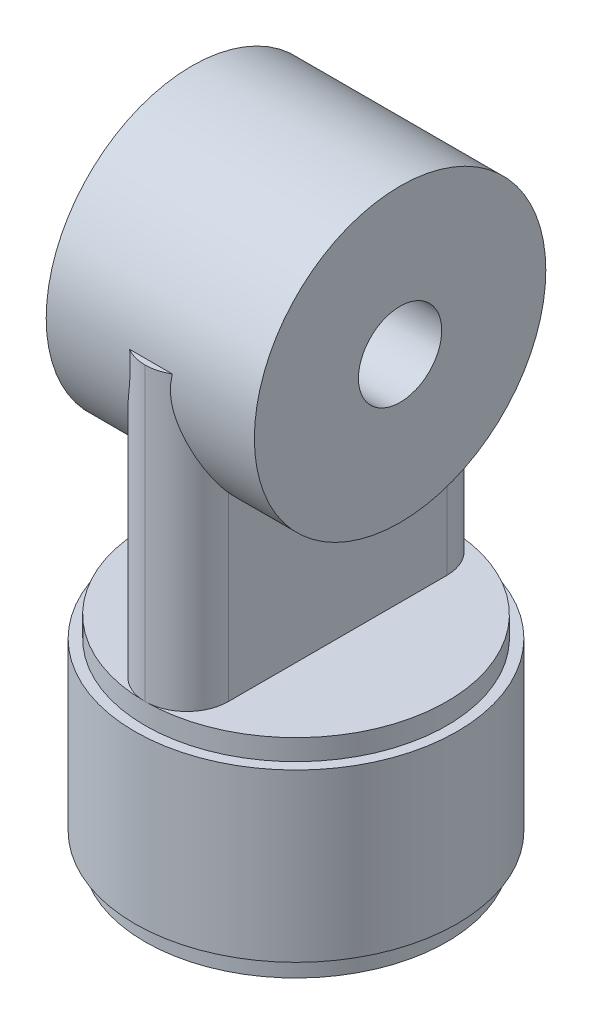
from build123d import *
from build123d.topology import SkipClean

# Parameters (mm, degrees)
BOSS_EXTRU_1_START      = 70
BOSS_EXTRU_1_DEPTH      = 70
BOSS_EXTRU_2_DEPTH      = 25
ESQUISSE7_R             = 10
ENL_V_MAT_EXTRU_1_DEPTH = 50
CONG_3_R                = 10
ECHELLE1_SCALE          = 0.25


with BuildPart() as part:
    # Esquisse1 → Révolution1 (revolve)
    with BuildSketch(Plane.XY, mode=Mode.PRIVATE) as r_volution1_sk:
        with BuildLine():
            Line((-5, 34.242293075), (-36.242368939, 34.242293075))
            Line((-36.242368939, 34.242293075), (-36.242368939, 39.242293075))
            Line((-36.242368939, 39.242293075), (-38.705375435, 39.242293075))
            Line((-38.705375435, 39.242293075), (-38.705375435, 79.242293075))
            Line((-38.705375435, 79.242293075), (-36.242368939, 79.242293075))
            Line((-36.242368939, 79.242293075), (-36.242368939, 84.242293075))
            Line((-36.242368939, 84.242293075), (-32, 84.242293075))
            Line((-32, 84.242293075), (0, 84.242293075))
            Line((0, 84.242293075), (0, 81.713773078))
            Line((0, 81.713773078), (-32, 81.713773078))
            Line((-32, 81.713773078), (-32, 51.242293075))
            ThreePointArc((-32, 51.242293075), (-31.414213562, 49.828079513), (-30, 49.242293075))
            Line((-30, 49.242293075), (-25, 49.242293075))
            Line((-25, 49.242293075), (-25, 46.233820065))
            Line((-25, 46.233820065), (-5, 46.233820065))
            Line((-5, 46.233820065), (-5, 34.242293075))
        make_face()
    revolve(r_volution1_sk.sketch.rotate(Axis((0, 190.222222222, 0), (0, -1, 0)), 270), axis=Axis((0, 190.222222222, 0), (0, -1, 0)))

    # Esquisse2 → Boss.-Extru.1 (add)
    with SkipClean():  # the faces are left unmerged after this step: merging them gives an invalid solid
        with BuildSketch(Plane(origin=(0, 84.242293075, 0), x_dir=(1, 0, 0), z_dir=(0, 1, 0)).offset(BOSS_EXTRU_1_START)):
            with BuildLine():
                Line((-10, 34.835460472), (-10, -34.835460472))
                ThreePointArc((-10, -34.835460472), (0, -36.242368939), (10, -34.835460472))
                Line((10, -34.835460472), (10, 34.835460472))
                ThreePointArc((10, 34.835460472), (0, 36.242368939), (-10, 34.835460472))
            make_face()
        extrude(amount=-BOSS_EXTRU_1_DEPTH)

    # Esquisse6 → Boss.-Extru.2 (add, symmetric)
    with SkipClean():  # the faces are left unmerged after this step: merging them gives an invalid solid
        with BuildSketch(Plane.ZY):
            with BuildLine():
                ThreePointArc((-34.835460472, 154.242293075), (0, 185.852500498), (34.835460472, 154.242293075))
                ThreePointArc((34.835460472, 154.242293075), (0, 115.852500498), (-34.835460472, 154.242293075))
            make_face()
        extrude(amount=BOSS_EXTRU_2_DEPTH, both=True)

    # Esquisse7 → Enlèv. mat.-Extru.1 (cut)
    with SkipClean():  # the faces are left unmerged after this step: merging them gives an invalid solid
        with BuildSketch(Plane.ZY.offset(25)):
            with Locations((0, 150.852500498)):
                Circle(ESQUISSE7_R)
        extrude(amount=-ENL_V_MAT_EXTRU_1_DEPTH, mode=Mode.SUBTRACT)

    # Congé3
    # the kernel refuses this fillet: 10 mm, written as the material it takes off along each edge
    with BuildSketch(Plane(origin=(10, 172.708919448, 34.835460472), x_dir=(-0.9902475852004595, 0, 0.1393187711855749), z_dir=(0, -1, 0))) as cong_3_piece_1_section:
        with BuildLine():
            CenterArc((8.705296899, 9.902475852), CONG_3_R, 188.0084284, 90)
            Line((-1.197178953, 8.50928814), (0, 0))
            ThreePointArc((0, 0), (5.049242305, -0.353450615), (10.098484611, 0))
        make_face()
    cong_3_piece_1 = extrude(amount=88.466626373, mode=Mode.PRIVATE)
    cong_3_piece_1 = cong_3_piece_1 - Plane(origin=(7.456754733, 150.852500498, 0), x_dir=(0, 0.09685121648897653, -0.9952988706235959), z_dir=(-1, 0, 0)) * Cylinder(35, 218, mode=Mode.PRIVATE)
    add(cong_3_piece_1, mode=Mode.SUBTRACT)
    with BuildSketch(Plane(origin=(10, 172.708919448, -34.835460472), x_dir=(-0.9902475852004589, 0, -0.13931877118558042), z_dir=(0, -1, 0))) as cong_3_piece_2_section:
        with BuildLine():
            CenterArc((8.705296899, -9.902475852), CONG_3_R, 81.9915716, 90)
            Line((-1.197178953, -8.50928814), (0, 0))
            ThreePointArc((0, 0), (5.049242305, 0.353450615), (10.098484611, 0))
        make_face()
    cong_3_piece_2 = extrude(amount=88.466626373, mode=Mode.PRIVATE)
    cong_3_piece_2 = cong_3_piece_2 - Plane(origin=(7.456771832, 150.852500498, 0), x_dir=(0, 0.09685121648897653, -0.9952988706235959), z_dir=(-1, 0, 0)) * Cylinder(35, 218, mode=Mode.PRIVATE)
    add(cong_3_piece_2, mode=Mode.SUBTRACT)
    with BuildSketch(Plane(origin=(-10, 172.708919448, -34.835460472), x_dir=(0.990247585200459, 0, -0.13931877118557906), z_dir=(0, -1, 0))) as cong_3_piece_3_section:
        with BuildLine():
            CenterArc((8.705296899, 9.902475852), CONG_3_R, 188.0084284, 90)
            Line((-1.197178953, 8.50928814), (0, 0))
            ThreePointArc((0, 0), (5.049242305, -0.353450615), (10.098484611, 0))
        make_face()
    cong_3_piece_3 = extrude(amount=88.466626373, mode=Mode.PRIVATE)
    cong_3_piece_3 = cong_3_piece_3 - Plane(origin=(-7.456771832, 150.852500498, 0), x_dir=(0, 0.09685121648897653, -0.9952988706235959), z_dir=(-1, 0, 0)) * Cylinder(35, 218, mode=Mode.PRIVATE)
    add(cong_3_piece_3, mode=Mode.SUBTRACT)
    with BuildSketch(Plane(origin=(-10, 172.708919448, 34.835460472), x_dir=(0.9902475852004595, 0, 0.1393187711855749), z_dir=(0, -1, 0))) as cong_3_piece_4_section:
        with BuildLine():
            CenterArc((8.705296899, -9.902475852), CONG_3_R, 81.9915716, 90)
            Line((-1.197178953, -8.50928814), (0, 0))
            ThreePointArc((0, 0), (5.049242305, 0.353450615), (10.098484611, 0))
        make_face()
    cong_3_piece_4 = extrude(amount=88.466626373, mode=Mode.PRIVATE)
    cong_3_piece_4 = cong_3_piece_4 - Plane(origin=(-7.456754733, 150.852500498, 0), x_dir=(0, 0.09685121648897653, -0.9952988706235959), z_dir=(-1, 0, 0)) * Cylinder(35, 218, mode=Mode.PRIVATE)
    add(cong_3_piece_4, mode=Mode.SUBTRACT)


with BuildPart() as part_1:
    # Echelle1: scaled about (0, 111.005849146, 2.25e-07)
    add(part.part.scale(ECHELLE1_SCALE).moved(Location((0, 83.25438686, 1.69e-07))))


solid = part_1.part
